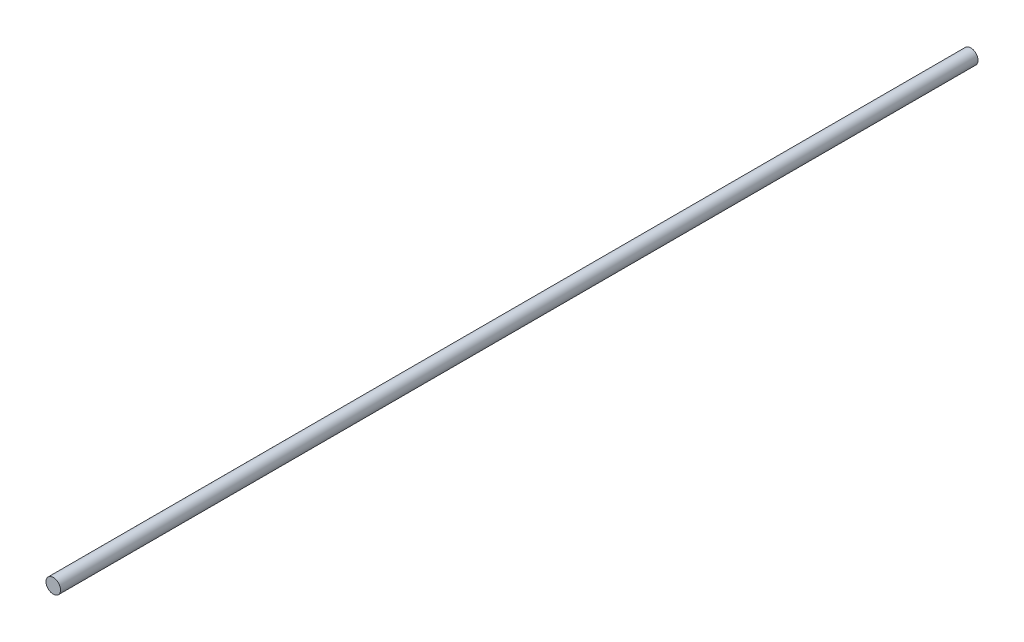
from build123d import *

# Parameters (mm, degrees)
F_3DSKETCH1_R       = 2.38125
BOSS_EXTRUDE1_DEPTH = 300


with BuildPart() as part:
    # 3DSketch1 → Boss-Extrude1 (new body)
    with BuildSketch(Plane(origin=(0, 0, 0), x_dir=(-1, 0, 0), z_dir=(0, 0, -1))):
        Circle(F_3DSKETCH1_R)
    extrude(amount=-BOSS_EXTRUDE1_DEPTH)


solid = part.part
